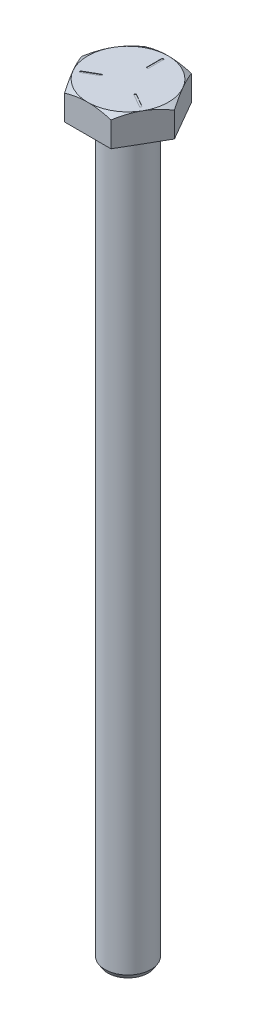
from build123d import *

# Parameters (mm, degrees)
BOSS_EXTRUDE1_DEPTH = 3.9624
CUT_EXTRUDE1_DEPTH  = 0.0508


with BuildPart() as part:
    # Sketch1 → Boss-Extrude1 (new body)
    with BuildSketch(Plane(origin=(0, 0, 0), x_dir=(1, 0, 0), z_dir=(0, 1, 0))):
        Polygon((6.415804866, 0), (3.207902433, 5.55625), (-3.207902433, 5.55625), (-6.415804866, 0), (-3.207902433, -5.55625), (3.207902433, -5.55625), align=None)
    extrude(amount=BOSS_EXTRUDE1_DEPTH)

    # Sketch2 → Cut-Revolve1 (revolve, cut)
    with BuildSketch(Plane.XY):
        Polygon((5.55625, 3.9624), (6.415804866, 3.4544), (6.415804866, 3.9624), align=None)
    revolve(axis=Axis((0, 0, 0), (0, 1, 0)), mode=Mode.SUBTRACT)

    # Sketch3 → Cut-Extrude1 (cut)
    with BuildSketch(Plane(origin=(0, 3.9624, 0), x_dir=(-1, 0, 0), z_dir=(0, -1, 0))):
        with BuildLine():
            Line((0.127, 4.7625), (0.127, 2.7305))
            ThreePointArc((0.127, 2.7305), (0, 2.6035), (-0.127, 2.7305))
            Line((-0.127, 2.7305), (-0.127, 4.7625))
            ThreePointArc((-0.127, 4.7625), (0, 4.8895), (0.127, 4.7625))
        make_face()
        with BuildLine():
            Line((4.060945986, -2.491235226), (2.301182365, -1.475235226))
            ThreePointArc((2.301182365, -1.475235226), (2.254697139, -1.30175), (2.428182365, -1.255264774))
            Line((2.428182365, -1.255264774), (4.187945986, -2.271264774))
            ThreePointArc((4.187945986, -2.271264774), (4.234431212, -2.44475), (4.060945986, -2.491235226))
        make_face()
        with BuildLine():
            Line((-4.187945986, -2.271264774), (-2.428182365, -1.255264774))
            ThreePointArc((-2.428182365, -1.255264774), (-2.254697139, -1.30175), (-2.301182365, -1.475235226))
            Line((-2.301182365, -1.475235226), (-4.060945986, -2.491235226))
            ThreePointArc((-4.060945986, -2.491235226), (-4.234431212, -2.44475), (-4.187945986, -2.271264774))
        make_face()
    extrude(amount=CUT_EXTRUDE1_DEPTH, mode=Mode.SUBTRACT)

    # Bolt Length Sketch → Bolt Length (revolve)
    with BuildSketch(Plane.XY):
        Polygon((0, 0), (0, -101.6), (2.778125, -101.6), (3.175, -100.965), (3.175, 0), align=None)
    revolve(axis=Axis((0, 0, 0), (0, -1, 0)))


solid = part.part
